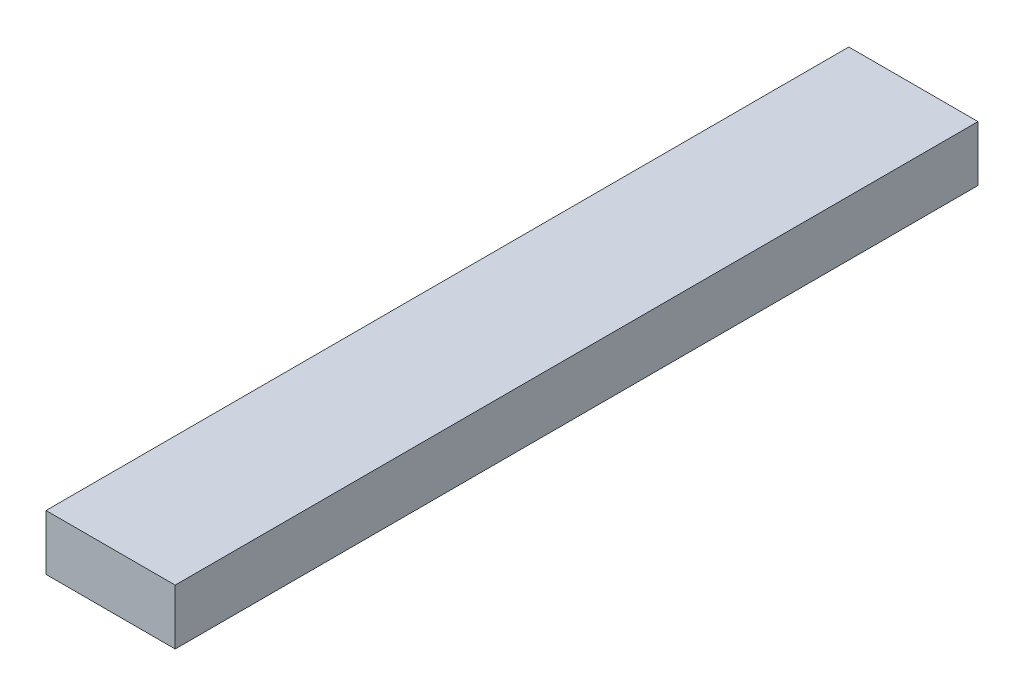
from build123d import *

# Parameters (mm, degrees)
SKETCH1_W           = 88.9
SKETCH1_H           = 38.1
BOSS_EXTRUDE1_DEPTH = 552.45


with BuildPart() as part:
    # Sketch1 → Boss-Extrude1 (new body)
    with BuildSketch(Plane.XY):
        with Locations((44.45, 19.05)):
            Rectangle(SKETCH1_W, SKETCH1_H)
    extrude(amount=BOSS_EXTRUDE1_DEPTH)


solid = part.part
